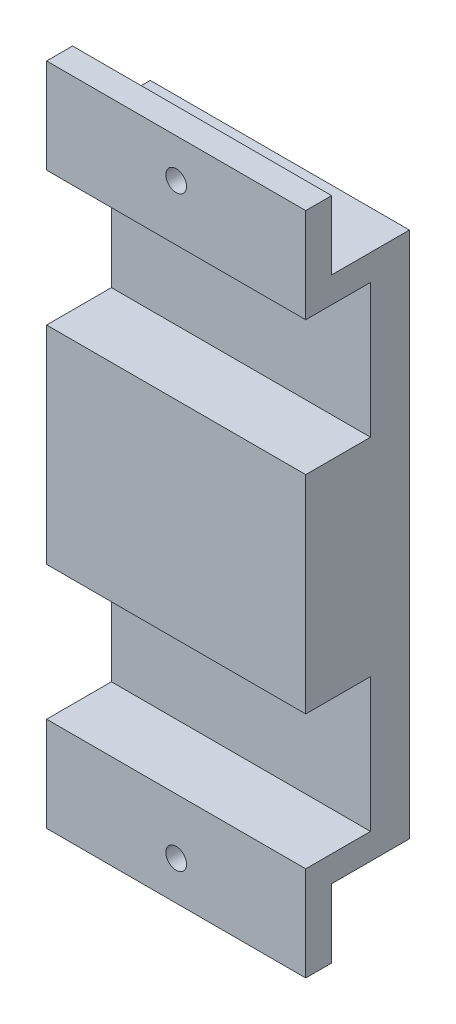
from build123d import *

# Parameters (mm, degrees)
EXTRUDE_1_DEPTH     = 10
SKETCH_2_R          = 0.4
CUT_EXTRUDE_1_DEPTH = 15.682716688


with BuildPart() as part:
    # Эскиз1 → Бобышка-Вытянуть1 (new body)
    with BuildSketch(Plane(origin=(0, 0, 0), x_dir=(0, 0, -1), z_dir=(1, 0, 0))):
        Polygon((0, 0), (0, 2.50113593), (1, 2.50113593), (1, -0.14886407), (4, -0.14886407), (4, -10.32386407), (0, -10.32386407), (0, -6.32386407), (2.5, -6.32386407), (2.5, -1.14886407), (0, -1.14886407), align=None)
    extrude_1 = extrude(amount=EXTRUDE_1_DEPTH)

    # Эскиз2 → Вырез-Вытянуть1 (cut, through all)
    with BuildSketch(Plane(origin=(0, 0, -1), x_dir=(-1, 0, 0), z_dir=(0, 0, -1))):
        with Locations((-5, 1.00113593)):
            Circle(SKETCH_2_R)
    cut_extrude_1 = extrude(amount=-CUT_EXTRUDE_1_DEPTH, mode=Mode.SUBTRACT)

    # Зеркальное отражение1: Бобышка-Вытянуть1, Вырез-Вытянуть1 across plane
    add(extrude_1.mirror(Plane(origin=(10, -10.32386407, -4), x_dir=(0, 0, 1), z_dir=(0, 1, 0))))
    add(cut_extrude_1.mirror(Plane(origin=(10, -10.32386407, -4), x_dir=(0, 0, 1), z_dir=(0, 1, 0))), mode=Mode.SUBTRACT)


solid = part.part
